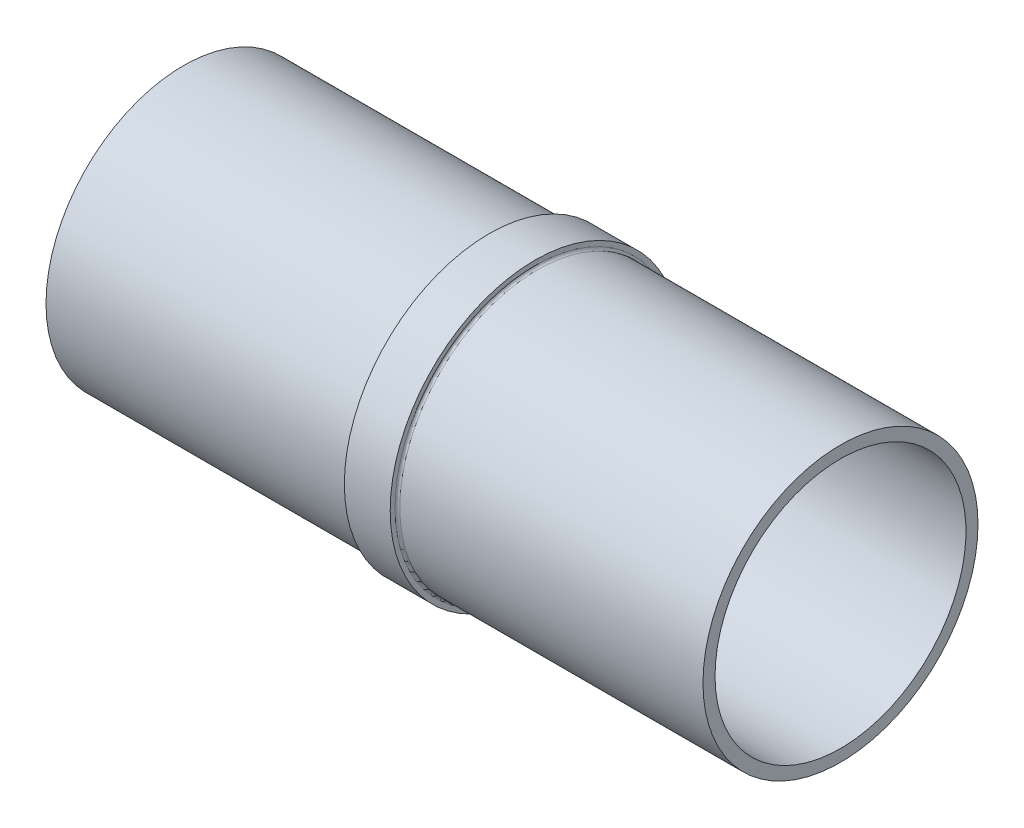
from build123d import *


with BuildPart() as part:
    # Sketch1 → Revolve1 (revolve)
    with BuildSketch(Plane(origin=(0, 0, 0), x_dir=(1, 0, 0), z_dir=(0, 1, 0))):
        with BuildLine():
            Line((0, 52.15), (-74.2, 52.15))
            ThreePointArc((-74.2, 52.15), (-75.614213562, 51.564213562), (-76.2, 50.15))
            Line((-76.2, 50.15), (-76.2, 42.15))
            Line((-76.2, 42.15), (-95.7, 42.15))
            Line((-95.7, 42.15), (-95.7, 50.15))
            ThreePointArc((-95.7, 50.15), (-96.285786438, 51.564213562), (-97.7, 52.15))
            Line((-97.7, 52.15), (-273.05, 52.15))
            Line((-273.05, 52.15), (-273.05, 57.15))
            Line((-273.05, 57.15), (-147.05, 57.15))
            ThreePointArc((-147.05, 57.15), (-146.342893219, 57.442893219), (-146.05, 58.15))
            Line((-146.05, 58.15), (-146.05, 60.15))
            Line((-146.05, 60.15), (-127, 60.15))
            Line((-127, 60.15), (-127, 58.15))
            ThreePointArc((-127, 58.15), (-126.707106781, 57.442893219), (-126, 57.15))
            Line((-126, 57.15), (0, 57.15))
            Line((0, 57.15), (0, 52.15))
        make_face()
    revolve(axis=Axis((-185.768615225, 0, 0), (1, 0, 0)))


solid = part.part
